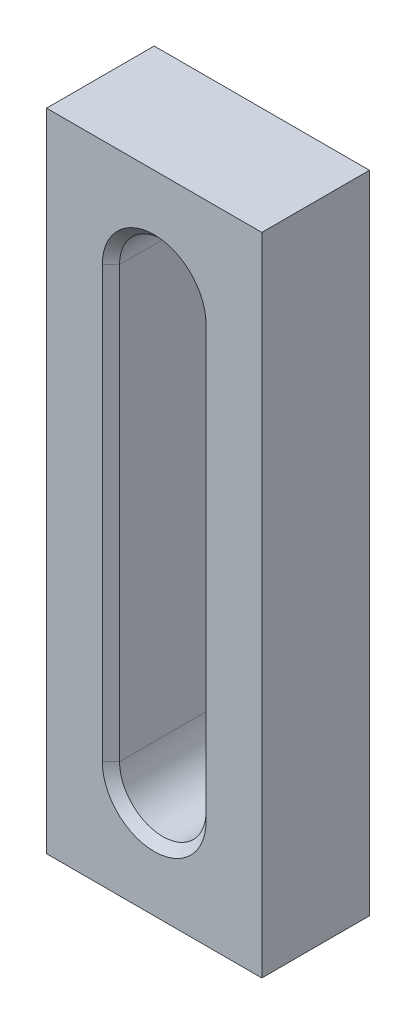
from build123d import *

# Parameters (mm, degrees)
SKETCH_1_W          = 50
SKETCH_1_H          = 150
EXTRUDE_1_DEPTH     = 25
CUT_EXTRUDE_1_DEPTH = 161.078105936
CHAMFER_1_SIZE      = 2


with BuildPart() as part:
    # Эскиз1 → Бобышка-Вытянуть1 (new body)
    with BuildSketch(Plane.XY):
        with Locations((25, 75)):
            Rectangle(SKETCH_1_W, SKETCH_1_H)
    extrude(amount=EXTRUDE_1_DEPTH)

    # Эскиз2 → Вырез-Вытянуть1 (cut, through all)
    with BuildSketch(Plane.XY.offset(25)):
        with BuildLine():
            Line((14.95, 25), (14.95, 125))
            ThreePointArc((14.95, 125), (25, 135.05), (35.05, 125))
            Line((35.05, 125), (35.05, 25))
            ThreePointArc((35.05, 25), (25, 14.95), (14.95, 25))
        make_face()
    extrude(amount=-CUT_EXTRUDE_1_DEPTH, mode=Mode.SUBTRACT)

    # Фаска1
    chamfer_1_edges = [part.edges().sort_by_distance(p)[0] for p in [
        (14.95, 75, 0),
        (25, 14.95, 0),
        (25, 135.05, 0),
        (35.05, 75, 0),
        (35.05, 75, 25),
        (25, 135.05, 25),
        (25, 14.95, 25),
        (14.95, 75, 25),
    ]]
    chamfer(chamfer_1_edges, length=CHAMFER_1_SIZE)


solid = part.part
